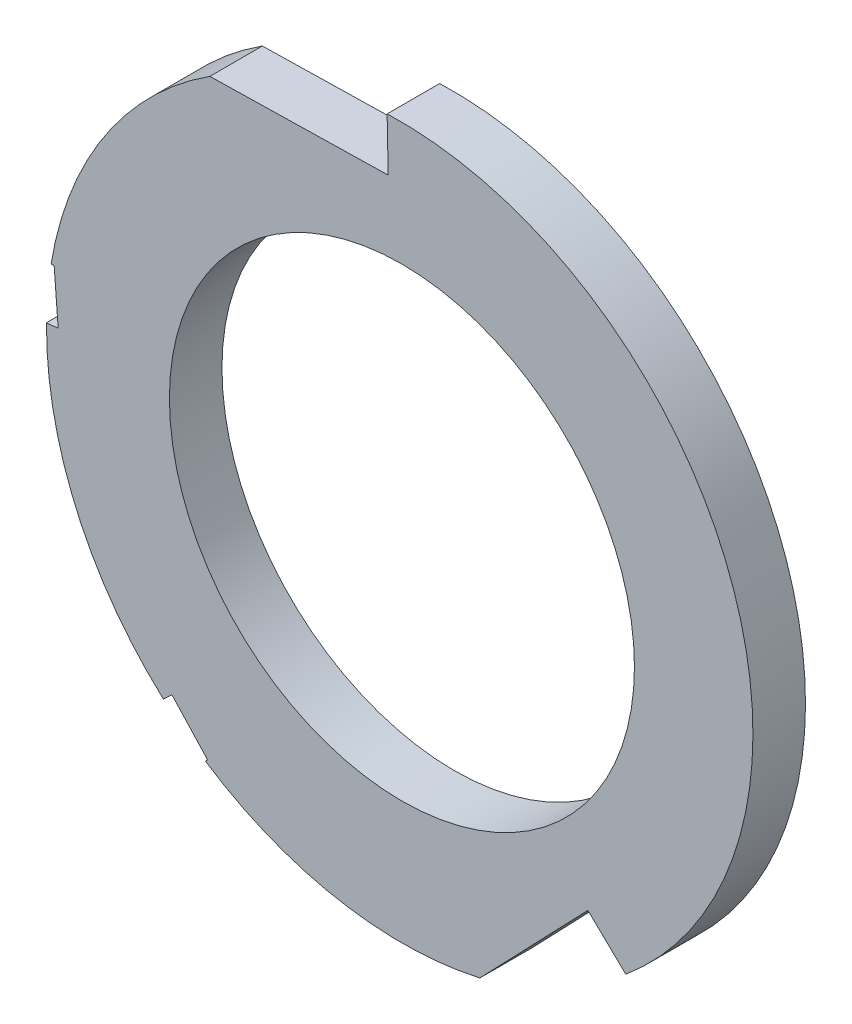
from build123d import *

# Parameters (mm, degrees)
SKETCH1_R           = 6.7437
BOSS_EXTRUDE1_DEPTH = 1.524


with BuildPart() as part:
    # Sketch1 → Boss-Extrude1 (new body)
    with BuildSketch(Plane.XY):
        with BuildLine():
            Line((9.038930172, 5.397352948), (9.069912734, 3.873667915))
            Line((9.069912734, 3.873667915), (3.896628417, 3.768474521))
            ThreePointArc((3.896628417, 3.768474521), (0.84852896, 0.749318265), (-0.706647489, -3.249136564))
            Line((-0.706647489, -3.249136564), (-0.618556368, -3.242322967))
            Line((-0.618556368, -3.242322967), (-0.501030349, -4.761784594))
            Line((-0.501030349, -4.761784594), (-0.83984188, -4.787990699))
            ThreePointArc((-0.83984188, -4.787990699), (0.021484966, -9.03170755), (2.549623891, -12.547319904))
            Line((2.549623891, -12.547319904), (2.799079706, -12.316556369))
            Line((2.799079706, -12.316556369), (3.833980545, -13.435286119))
            Line((3.833980545, -13.435286119), (3.769121942, -13.495284722))
            ThreePointArc((3.769121942, -13.495284722), (7.598553089, -15.043003967), (11.728156775, -14.96330978))
            Line((11.728156775, -14.96330978), (14.861408358, -11.697546747))
            Line((14.861408358, -11.697546747), (15.961119013, -12.752635594))
            ThreePointArc((15.961119013, -12.752635594), (18.974662894, -1.20829161), (9.038930172, 5.397352948))
        make_face()
        with Locations((9.468478572, -4.905028475)):
            Circle(SKETCH1_R, mode=Mode.SUBTRACT)
    extrude(amount=BOSS_EXTRUDE1_DEPTH)


solid = part.part
